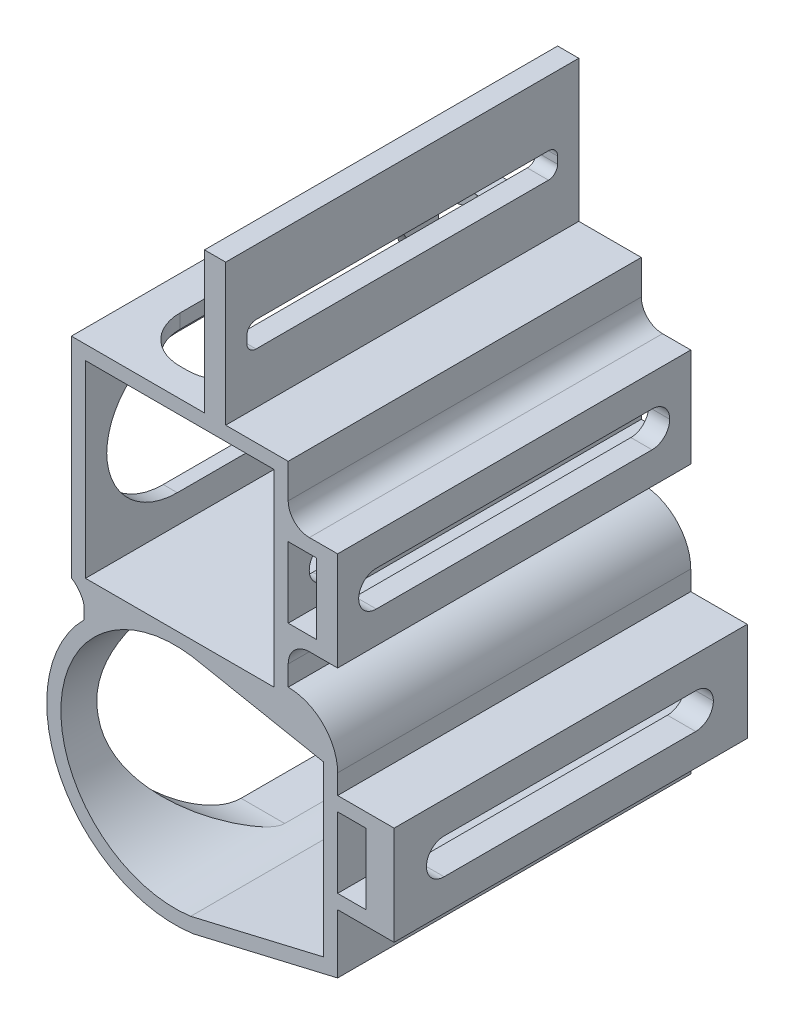
from build123d import *

# Parameters (mm, degrees)
CROQUIS3_W                  = 26.7
CROQUIS3_H                  = 26.7
CROQUIS3_W_2                = 4
CROQUIS3_H_2                = 25.7
SALIENTE_EXTRUIR1_DEPTH     = 50
SALIENTE_EXTRUIR2_DEPTH     = 50
CORTAR_EXTRUIR12_REACH      = 81.385
REDONDEO1_R                 = 2.5
CORTAR_EXTRUIR14_REACH      = 76.692
REDONDEO2_R                 = 2.5
REDONDEO4_DEPTH             = 50
CORTAR_EXTRUIR17_REACH      = 81.89
CORTAR_EXTRUIR17_END_RADIUS = 16.15
CORTAR_EXTRUIR18_REACH      = 79.272
CROQUIS17_W                 = 44
CROQUIS17_H                 = 19.7
REDONDEO5_R                 = 10
CORTAR_EXTRUIR19_REACH      = 96.589
CROQUIS18_W                 = 7
CROQUIS18_H                 = 42
CROQUIS19_W                 = 4
CROQUIS19_H                 = 2
CROQUIS19_W_2               = 3
CROQUIS19_H_2               = 20
SALIENTE_EXTRUIR3_DEPTH     = 50
CORTAR_EXTRUIR20_REACH      = 82.564
CROQUIS20_W                 = 44
CROQUIS20_H                 = 3.6
CORTAR_EXTRUIR21_REACH      = 91.506
CROQUIS21_W                 = 3
CROQUIS21_H                 = 5.85
REDONDEO6_R                 = 3
REDONDEO8_R                 = 7
REDONDEO9_R                 = 1.3
CORTAR_EXTRUIR22_REACH      = 96.589
CROQUIS22_W                 = 7
CROQUIS22_H                 = 42
REDONDEO10_R                = 6.5


with BuildPart() as part:
    # Croquis3 → Saliente-Extruir1 (new body)
    with BuildSketch(Plane.XY):
        with BuildLine():
            Line((-43.857247249, 7.480922369), (-42.099195701, 7.480922369))
            Line((-42.099195701, 7.480922369), (-42.099195701, 3.245032209))
            ThreePointArc((-42.099195701, 3.245032209), (-45.398833914, -17.697170572), (-26.590955846, -27.481197975))
            Line((-26.590955846, -27.481197975), (-6.157247249, -22.679560551))
            Line((-6.157247249, -22.679560551), (-6.157247249, 37.180922369))
            Line((-6.157247249, 37.180922369), (-27.007247249, 37.180922369))
            Line((-27.007247249, 37.180922369), (-43.857247249, 37.180922369))
            Line((-43.857247249, 37.180922369), (-43.857247249, 7.480922369))
        make_face()
        with Locations((-28.507247249, 21.830922369)):
            Rectangle(CROQUIS3_W, CROQUIS3_H, mode=Mode.SUBTRACT)
        with Locations((-11.157247249, 22.330922369)):
            Rectangle(CROQUIS3_W_2, CROQUIS3_H_2, mode=Mode.SUBTRACT)
        with BuildLine():
            Line((-8.157247249, 2.82108494), (-26.731262437, 6.441781026))
            ThreePointArc((-26.731262437, 6.441781026), (-45.345288804, -9.402744466), (-26.961453667, -25.513783269))
            Line((-26.961453667, -25.513783269), (-8.157247249, -21.095056202))
            Line((-8.157247249, -21.095056202), (-8.157247249, 2.82108494))
        make_face(mode=Mode.SUBTRACT)
    extrude(amount=SALIENTE_EXTRUIR1_DEPTH)

    # Croquis11 → Saliente-Extruir2 (add)
    with BuildSketch(Plane(origin=(0, 0, 0), x_dir=(-1, 0, 0), z_dir=(0, 0, -1))):
        Polygon((-1.842752751, -14.302804028), (-1.842752751, -0.302804028), (6.157247249, -0.302804028), (6.157247249, -2.302804028), (2.157247249, -2.302804028), (2.157247249, -12.302804028), (6.157247249, -12.302804028), (6.157247249, -14.302804028), align=None)
    extrude(amount=-SALIENTE_EXTRUIR2_DEPTH)

    # Cortar-Extruir12: up to this face of the body (flat: up to its plane)
    cortar_extruir12_end = Plane(part.part.faces().sort_by_distance((-8.157247249, -9.136985631, 25))[0])
    # Croquis12 → Cortar-Extruir12 (cut, up to the picked face)
    with BuildSketch(Plane(origin=(1.842752751, 0, 0), x_dir=(0, 0, -1), z_dir=(1, 0, 0)), mode=Mode.PRIVATE) as cortar_extruir12_sk1:
        Polygon((-25, -9.802804028), (-4.8, -9.802804028), (-4.8, -4.802804028), (-45.42287301, -4.802804028), (-45.42287301, -9.802804028), align=None)
    cortar_extruir12_tool1 = split(extrude(cortar_extruir12_sk1.sketch, amount=-CORTAR_EXTRUIR12_REACH, mode=Mode.PRIVATE), bisect_by=cortar_extruir12_end, keep=Keep.BOTH, mode=Mode.PRIVATE)
    add(cortar_extruir12_tool1.solids().sort_by(Axis((1.842753, -7.302804, 25.111437), (-1, 0, 0)))[0], mode=Mode.SUBTRACT)

    # Redondeo1
    redondeo1_edges = [part.edges().sort_by_distance(p)[0] for p in [
        (-0.157247249, -4.802804028, 4.8),
        (-0.157247249, -9.802804028, 4.8),
        (-0.157247249, -9.802804028, 45.42287301),
        (-0.157247249, -4.802804028, 45.42287301),
        (-7.157247249, -9.802804028, 4.8),
        (-7.157247249, -4.802804028, 4.8),
        (-7.157247249, -9.802804028, 45.42287301),
        (-7.157247249, -4.802804028, 45.42287301),
    ]]
    fillet(redondeo1_edges, radius=REDONDEO1_R - 0.0001)  # a hair under: the kernel refuses the full size

    # Cortar-Extruir14: up to this face of the body (flat: up to its plane)
    cortar_extruir14_end = Plane(part.part.faces().sort_by_distance((-15.157247249, 21.830922369, 25))[0])
    # Croquis14 → Cortar-Extruir14 (cut, up to the picked face)
    with BuildSketch(Plane(origin=(-6.157247249, 0, 0), x_dir=(0, 0, -1), z_dir=(1, 0, 0)), mode=Mode.PRIVATE) as cortar_extruir14_sk1:
        Polygon((-2.979356026, 22.330922369), (-2.979356026, 19.830922369), (-47.020643974, 19.830922369), (-47.020643974, 22.330922369), (-47.020643974, 24.830922369), (-2.979356026, 24.830922369), align=None)
    cortar_extruir14_tool1 = split(extrude(cortar_extruir14_sk1.sketch, amount=-CORTAR_EXTRUIR14_REACH, mode=Mode.PRIVATE), bisect_by=cortar_extruir14_end, keep=Keep.BOTH, mode=Mode.PRIVATE)
    add(cortar_extruir14_tool1.solids().sort_by(Axis((-6.157247, 22.330922, 25), (-1, 0, 0)))[0], mode=Mode.SUBTRACT)

    # Redondeo2
    redondeo2_edges = [part.edges().sort_by_distance(p)[0] for p in [
        (-14.157247249, 24.830922369, 2.979356026),
        (-7.657247249, 24.830922369, 2.979356026),
        (-7.657247249, 19.830922369, 2.979356026),
        (-14.157247249, 19.830922369, 2.979356026),
        (-14.157247249, 24.830922369, 47.020643974),
        (-7.657247249, 24.830922369, 47.020643974),
        (-7.657247249, 19.830922369, 47.020643974),
        (-14.157247249, 19.830922369, 47.020643974),
    ]]
    fillet(redondeo2_edges, radius=REDONDEO2_R - 0.0001)  # a hair under: the kernel refuses the full size

    # Redondeo4: read off the stored shape, not the designer's step
    # Redondeo4 outline → Redondeo4 (add)
    with BuildSketch(Plane.XY):
        with BuildLine():
            Line((-42.099195701, 7.480922369), (-43.857247249, 7.480922369))
            add(Edge.make_bspline(
                [(-43.857247249, 7.480922369), (-42.099195701, 6.934552825), (-42.099195701, 5.093557191)],
                knots=[0, 0, 0, 1, 1, 1], degree=2, weights=[1, 0.402613242, 1]))
            Line((-42.099195701, 5.093557191), (-42.099195701, 7.480922369))
        make_face()
    extrude(amount=REDONDEO4_DEPTH)

    # Cortar-Extruir17: up to this cylinder (the profile starts outside it)
    cortar_extruir17_end = Plane(origin=(-29.1957078, -9.519077631, 25), z_dir=(0, 0, -1)) * Cylinder(CORTAR_EXTRUIR17_END_RADIUS, 197.08, mode=Mode.PRIVATE)
    # Croquis16 → Cortar-Extruir17 (cut, up to the surface)
    with BuildSketch(Plane.ZY.offset(48.157247249), mode=Mode.PRIVATE) as cortar_extruir17_sk1:
        with BuildLine():
            Line((32, -25.481197975), (18, -25.481197975))
            ThreePointArc((18, -25.481197975), (8.807611845, -21.67358613), (5, -12.481197975))
            Line((5, -12.481197975), (5, -11.754967791))
            ThreePointArc((5, -11.754967791), (8.807611845, -2.562579636), (18, 1.245032209))
            Line((18, 1.245032209), (32, 1.245032209))
            ThreePointArc((32, 1.245032209), (41.192388155, -2.562579636), (45, -11.754967791))
            Line((45, -11.754967791), (45, -12.481197975))
            ThreePointArc((45, -12.481197975), (41.192388155, -21.67358613), (32, -25.481197975))
        make_face()
    cortar_extruir17_tool1 = extrude(cortar_extruir17_sk1.sketch, amount=-CORTAR_EXTRUIR17_REACH, mode=Mode.PRIVATE) - cortar_extruir17_end
    add(cortar_extruir17_tool1.solids().sort_by_distance((-48.157247, -12.118083, 25))[0], mode=Mode.SUBTRACT)

    # Croquis17 → Cortar-Extruir18 (cut, up to next)
    with BuildSketch(Plane.ZY.offset(43.857247249), mode=Mode.PRIVATE) as cortar_extruir18_sk1:
        with Locations((25, 22.330922369)):
            Rectangle(CROQUIS17_W, CROQUIS17_H)
    cortar_extruir18_tool1 = extrude(cortar_extruir18_sk1.sketch, amount=-CORTAR_EXTRUIR18_REACH, mode=Mode.PRIVATE) & part.part
    add(cortar_extruir18_tool1.solids().sort_by_distance((-43.857247, 22.330922, 25))[0], mode=Mode.SUBTRACT)

    # Redondeo5
    # the kernel refuses this fillet: 10 mm, written as the material it adds along each edge
    with BuildSketch(Plane(origin=(-43.857247249, 12.480922369, 47), x_dir=(0, 1, 0), z_dir=(1, 0, 0)), Plane(origin=(-43.857247249, 32.180922369, 47), x_dir=(0, 0, -1), z_dir=(1, 0, 0)), Plane(origin=(-43.857247249, 32.180922369, 3), x_dir=(0, -1, 0), z_dir=(1, 0, 0))) as redondeo5_piece_1:
        with BuildLine():
            CenterArc((REDONDEO5_R, -REDONDEO5_R), REDONDEO5_R, 90, 90)
            Line((0, -REDONDEO5_R), (0, 0))
            Line((0, 0), (REDONDEO5_R, 0))
        make_face()
    extrude(amount=2)
    with BuildSketch(Plane(origin=(-43.857247249, 12.480922369, 3), x_dir=(0, 1, 0), z_dir=(1, 0, 0))) as redondeo5_piece_2:
        with BuildLine():
            CenterArc((REDONDEO5_R, REDONDEO5_R), REDONDEO5_R, 180, 90)
            Line((0, REDONDEO5_R), (0, 0))
            Line((0, 0), (REDONDEO5_R, 0))
        make_face()
    extrude(amount=2)

    # Croquis18 → Cortar-Extruir19 (cut, up to next)
    with BuildSketch(Plane(origin=(0, 37.180922369, 0), x_dir=(1, 0, 0), z_dir=(0, 1, 0)), mode=Mode.PRIVATE) as cortar_extruir19_sk1:
        with Locations((-28.507247249, -25)):
            Rectangle(CROQUIS18_W, CROQUIS18_H)
    cortar_extruir19_tool1 = extrude(cortar_extruir19_sk1.sketch, amount=-CORTAR_EXTRUIR19_REACH, mode=Mode.PRIVATE) & part.part
    add(cortar_extruir19_tool1.solids().sort_by_distance((-28.507247, 37.180922, 25))[0], mode=Mode.SUBTRACT)

    # Croquis19 → Saliente-Extruir3 (add)
    with BuildSketch(Plane(origin=(0, 0, 0), x_dir=(-1, 0, 0), z_dir=(0, 0, -1))):
        with Locations((11.157247249, 16.330922369)):
            Rectangle(CROQUIS19_W, CROQUIS19_H)
        with Locations((11.157247249, 28.330922369)):
            Rectangle(CROQUIS19_W, CROQUIS19_H)
        with Locations((23.507247249, 47.180922369)):
            Rectangle(CROQUIS19_W_2, CROQUIS19_H_2)
    extrude(amount=-SALIENTE_EXTRUIR3_DEPTH)

    # Croquis20 → Cortar-Extruir20 (cut, up to next)
    with BuildSketch(Plane.ZY.offset(25.007247249), mode=Mode.PRIVATE) as cortar_extruir20_sk1:
        with Locations((25, 46.180922369)):
            Rectangle(CROQUIS20_W, CROQUIS20_H)
    cortar_extruir20_tool1 = extrude(cortar_extruir20_sk1.sketch, amount=-CORTAR_EXTRUIR20_REACH, mode=Mode.PRIVATE) & part.part
    add(cortar_extruir20_tool1.solids().sort_by_distance((-25.007247, 46.180922, 25))[0], mode=Mode.SUBTRACT)

    # Croquis21 → Cortar-Extruir21 (cut, up to next)
    with BuildSketch(Plane(origin=(0, 0, 0), x_dir=(-1, 0, 0), z_dir=(0, 0, -1)), mode=Mode.PRIVATE) as cortar_extruir21_sk1:
        Polygon((13.157247249, 35.180922369), (13.157247249, 37.180922369), (6.157247249, 37.180922369), (6.157247249, 29.330922369), (9.157247249, 29.330922369), (9.157247249, 35.180922369), align=None)
    cortar_extruir21_tool1 = extrude(cortar_extruir21_sk1.sketch, amount=-CORTAR_EXTRUIR21_REACH, mode=Mode.PRIVATE) & part.part
    # Croquis21 → Cortar-Extruir21 (cut, up to next)
    with BuildSketch(Plane(origin=(0, 0, 0), x_dir=(-1, 0, 0), z_dir=(0, 0, -1)), mode=Mode.PRIVATE) as cortar_extruir21_sk2:
        with Locations((7.657247249, 12.405922369)):
            Rectangle(CROQUIS21_W, CROQUIS21_H)
    cortar_extruir21_tool2 = extrude(cortar_extruir21_sk2.sketch, amount=-CORTAR_EXTRUIR21_REACH, mode=Mode.PRIVATE) & part.part
    add(cortar_extruir21_tool1.solids().sort_by_distance((-8.544727, 33.997602, 0))[0], mode=Mode.SUBTRACT)
    add(cortar_extruir21_tool2.solids().sort_by_distance((-7.657247, 12.405922, 0))[0], mode=Mode.SUBTRACT)

    # Redondeo6
    redondeo6_edges = [part.edges().sort_by_distance(p)[0] for p in [
        (-13.157247249, 15.330922369, 25),
        (-13.157247249, 29.330922369, 25),
    ]]
    fillet(redondeo6_edges, radius=REDONDEO6_R)

    # Redondeo8
    redondeo8_edges = [part.edges().sort_by_distance(p)[0] for p in [
        (-6.157247249, 9.480922369, 25),
    ]]
    fillet(redondeo8_edges, radius=REDONDEO8_R - 0.0001)  # a hair under: the kernel refuses the full size

    # Redondeo9
    redondeo9_edges = [part.edges().sort_by_distance(p)[0] for p in [
        (-23.507247249, 47.980922369, 3),
        (-23.507247249, 47.980922369, 47),
        (-23.507247249, 44.380922369, 47),
        (-23.507247249, 44.380922369, 3),
    ]]
    fillet(redondeo9_edges, radius=REDONDEO9_R)

    # Croquis22 → Cortar-Extruir22 (cut, up to next)
    with BuildSketch(Plane(origin=(0, 37.180922369, 0), x_dir=(1, 0, 0), z_dir=(0, 1, 0)), mode=Mode.PRIVATE) as cortar_extruir22_sk1:
        with Locations((-35.507247249, -25)):
            Rectangle(CROQUIS22_W, CROQUIS22_H)
    cortar_extruir22_tool1 = extrude(cortar_extruir22_sk1.sketch, amount=-CORTAR_EXTRUIR22_REACH, mode=Mode.PRIVATE) & part.part
    add(cortar_extruir22_tool1.solids().sort_by_distance((-35.507247, 37.180922, 25))[0], mode=Mode.SUBTRACT)

    # Redondeo10
    redondeo10_edges = [part.edges().sort_by_distance(p)[0] for p in [
        (-25.007247249, 36.180922369, 46),
        (-25.007247249, 36.180922369, 4),
        (-39.007247249, 36.180922369, 46),
        (-39.007247249, 36.180922369, 4),
    ]]
    fillet(redondeo10_edges, radius=REDONDEO10_R)


solid = part.part
